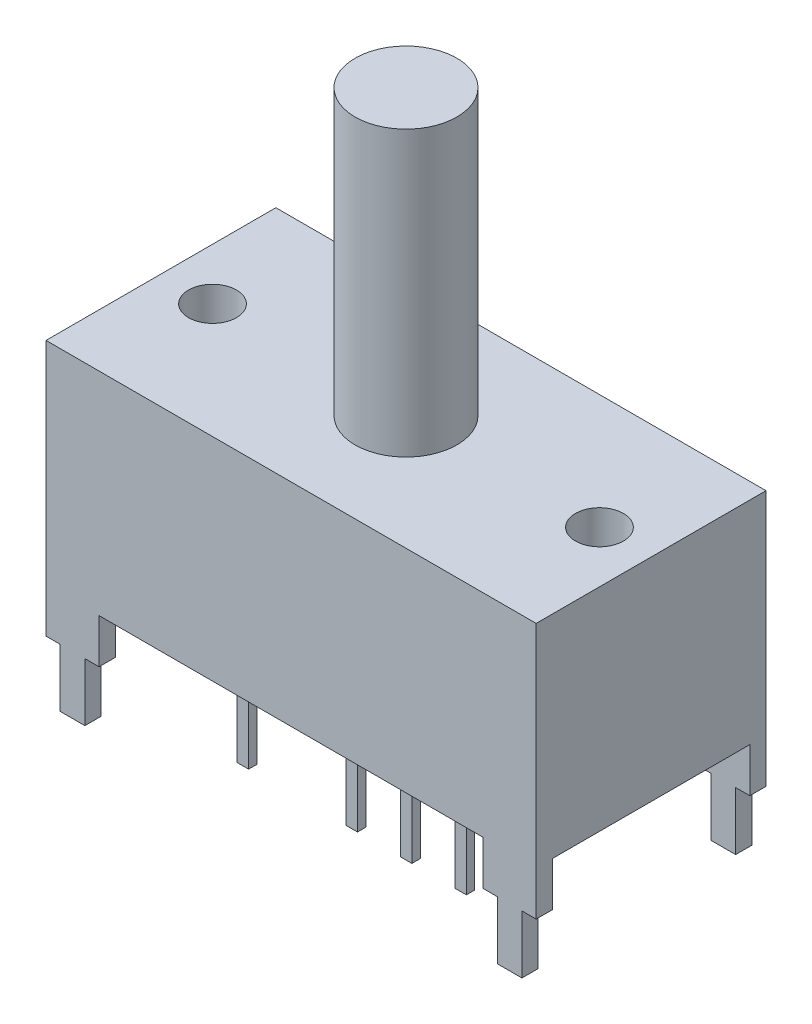
from build123d import *

# Parameters (mm, degrees)
SKETCH1_W               = 23.1
SKETCH1_H               = 10.8331
BOSS_EXTRUDE1_DEPTH     = 9.9822
SKETCH2_W               = 2.5019
SKETCH2_H               = 0.762
BOSS_EXTRUDE2_DEPTH     = 4.826
SKETCH3_W               = 0.5461
SKETCH3_H               = 0.3937
BOSS_EXTRUDE3_DEPTH     = 5.461
LPATTERN1_COUNT         = 5
LPATTERN1_PITCH         = 2.5654
LPATTERN1_COUNT_DIR2    = 2
LPATTERN1_PITCH_DIR2    = 5.08
SKETCH4_R               = 2.4003
BOSS_EXTRUDE4_DEPTH     = 13.3858
SKETCH5_R               = 1.1303
CUT_EXTRUDE1_DEPTH      = 2.54
CUT_EXTRUDE2_DEPTH      = 29.228035348
CUT_EXTRUDE2_DEPTH_BACK = 29.228035348
SKETCH6_W               = 0.669118354
SKETCH6_H               = 2.7382


with BuildPart() as part:
    # Sketch1 → Boss-Extrude1 (new body)
    with BuildSketch(Plane(origin=(0, 0, 0), x_dir=(1, 0, 0), z_dir=(0, 1, 0))):
        Rectangle(SKETCH1_W, SKETCH1_H)
    extrude(amount=BOSS_EXTRUDE1_DEPTH)

    # Sketch2 → Boss-Extrude2 (add)
    with BuildSketch(Plane.XZ):
        with Locations((10.29905, -5.03555)):
            Rectangle(SKETCH2_W, SKETCH2_H)
        with Locations((10.29905, 5.03555)):
            Rectangle(SKETCH2_W, SKETCH2_H)
        with Locations((-10.29905, 5.03555)):
            Rectangle(SKETCH2_W, SKETCH2_H)
        with Locations((-10.29905, -5.03555)):
            Rectangle(SKETCH2_W, SKETCH2_H)
    extrude(amount=BOSS_EXTRUDE2_DEPTH)

    # Sketch3 → Boss-Extrude3 (add)
    with BuildSketch(Plane.XZ):
        with Locations((5.26985, -2.5781)):
            Rectangle(SKETCH3_W, SKETCH3_H)
    boss_extrude3 = extrude(amount=BOSS_EXTRUDE3_DEPTH)

    # LPattern1: Boss-Extrude3 5 × 2, 2 skipped
    with Locations(*[(-i * LPATTERN1_PITCH, 0, j * LPATTERN1_PITCH_DIR2) for i in range(LPATTERN1_COUNT) for j in range(LPATTERN1_COUNT_DIR2) if (i, j) not in ((0, 0), (3, 0), (3, 1))]):
        add(boss_extrude3)

    # Sketch4 → Boss-Extrude4 (add)
    with BuildSketch(Plane(origin=(0, 9.9822, 0), x_dir=(1, 0, 0), z_dir=(0, 1, 0))):
        Circle(SKETCH4_R)
    extrude(amount=BOSS_EXTRUDE4_DEPTH)

    # Sketch5 → Cut-Extrude1 (cut)
    with BuildSketch(Plane(origin=(0, 9.9822, 0), x_dir=(1, 0, 0), z_dir=(0, 1, 0))):
        with Locations((9.1186, 0)):
            Circle(SKETCH5_R)
        with Locations((-9.1186, 0)):
            Circle(SKETCH5_R)
    extrude(amount=-CUT_EXTRUDE1_DEPTH, mode=Mode.SUBTRACT)

    # Sketch6 → Cut-Extrude2 (cut, two sides: drawn at the far end of the back side and taken through both)
    with BuildSketch(Plane(origin=(0, 0, -5.41655), x_dir=(-1, 0, 0), z_dir=(0, 0, -1)).offset(-CUT_EXTRUDE2_DEPTH_BACK)):
        with Locations((-11.215440823, -3.4569)):
            Rectangle(SKETCH6_W, SKETCH6_H)
        with Locations((-9.382659177, -3.4569)):
            Rectangle(SKETCH6_W, SKETCH6_H)
        with Locations((9.382659177, -3.4569)):
            Rectangle(SKETCH6_W, SKETCH6_H)
        with Locations((11.215440823, -3.4569)):
            Rectangle(SKETCH6_W, SKETCH6_H)
    extrude(amount=CUT_EXTRUDE2_DEPTH + CUT_EXTRUDE2_DEPTH_BACK, mode=Mode.SUBTRACT)


solid = part.part
